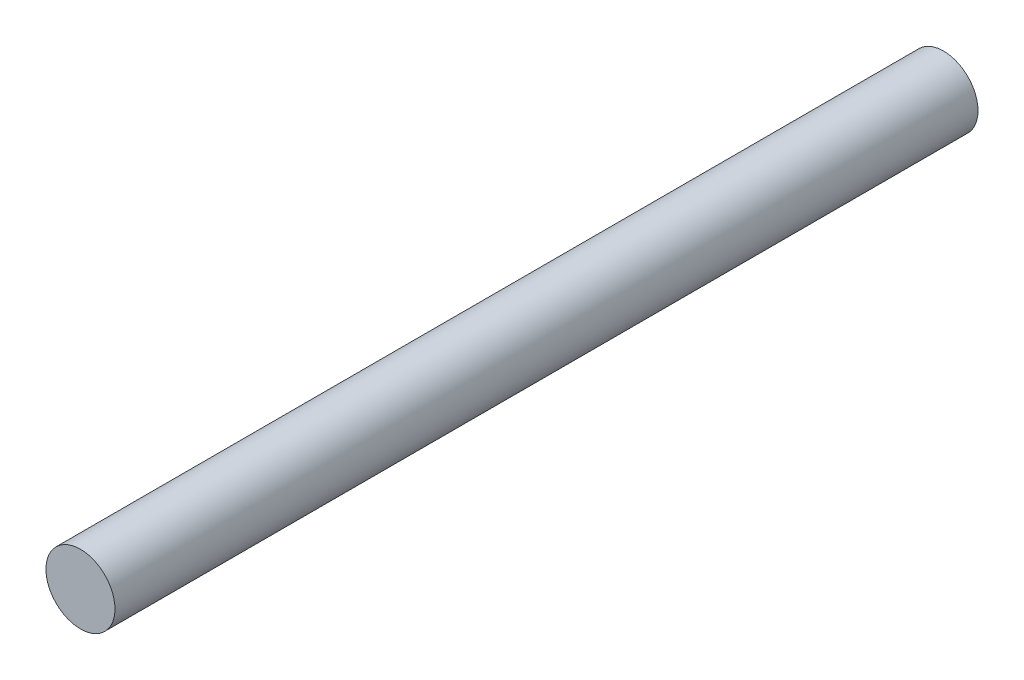
from build123d import *

# Parameters (mm, degrees)
SKETCH_1_R      = 10
EXTRUDE_1_DEPTH = 250


with BuildPart() as part:
    # ｽｹｯﾁ1 → ﾎﾞｽ - 押し出し1 (new body)
    with BuildSketch(Plane.XY):
        Circle(SKETCH_1_R)
    extrude(amount=EXTRUDE_1_DEPTH)


solid = part.part
